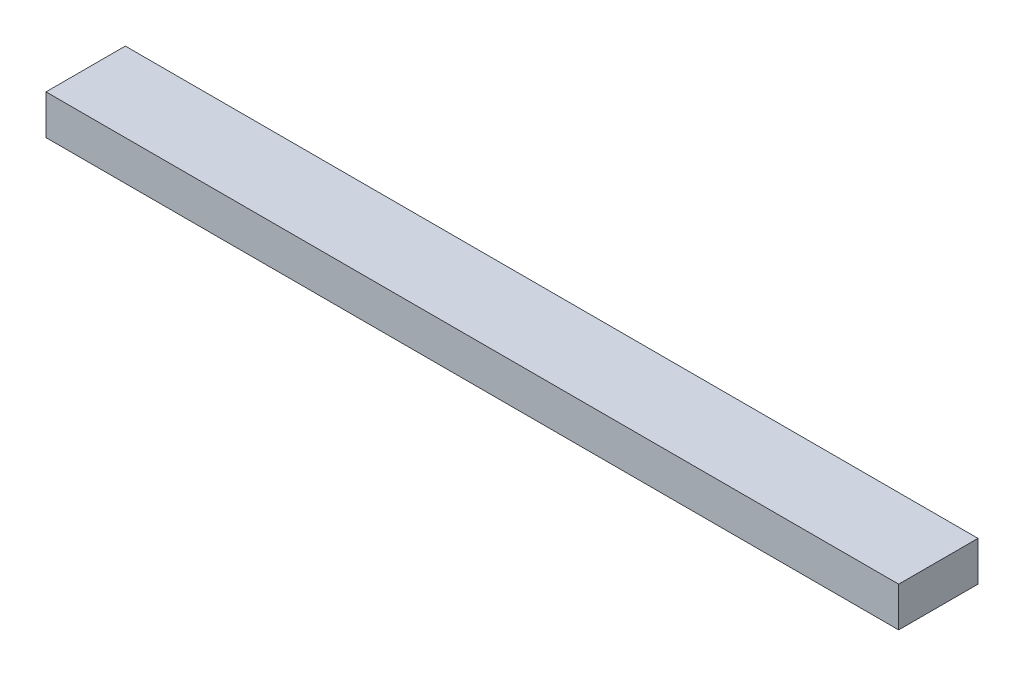
from build123d import *

# Parameters (mm, degrees)
SKETCH1_W           = 101.6
SKETCH1_H           = 50.8
BOSS_EXTRUDE1_DEPTH = 1092.2


with BuildPart() as part:
    # Sketch1 → Boss-Extrude1 (new body)
    with BuildSketch(Plane(origin=(0, 0, 0), x_dir=(0, 0, -1), z_dir=(1, 0, 0))):
        with Locations((50.8, 25.4)):
            Rectangle(SKETCH1_W, SKETCH1_H)
    extrude(amount=BOSS_EXTRUDE1_DEPTH)


solid = part.part
